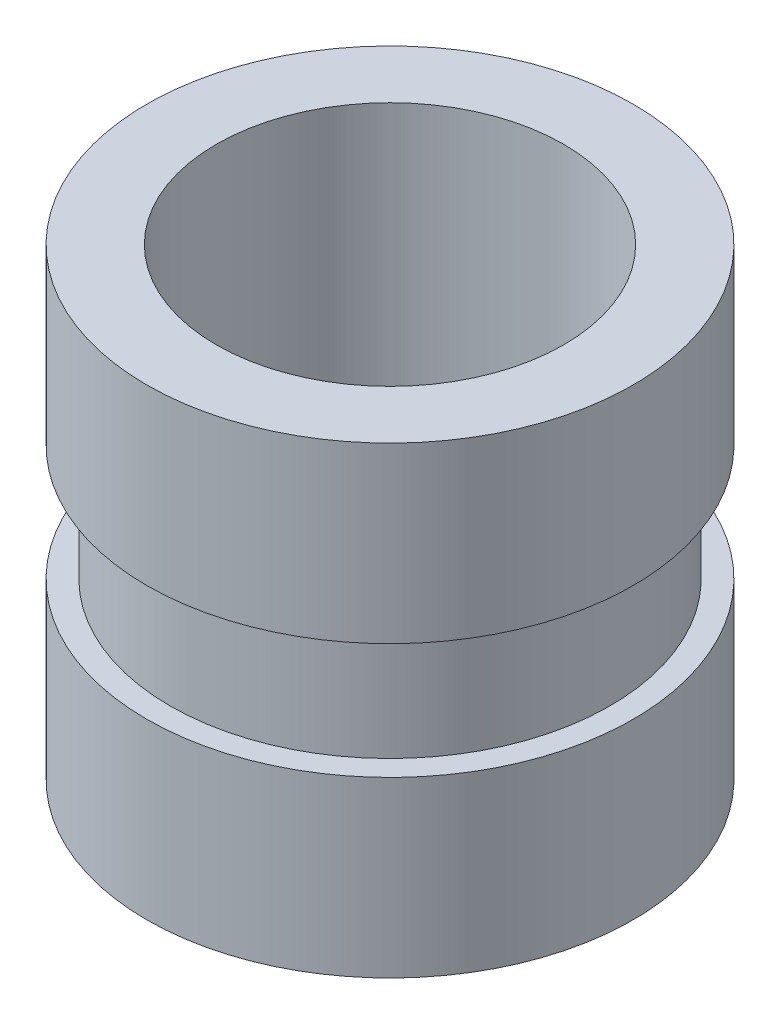
from build123d import *


with BuildPart() as part:
    # Sketch1 → Revolve1 (revolve)
    with BuildSketch(Plane.XY):
        Polygon((1.5, 0), (2.1, 0), (2.1, 1.5), (1.9, 1.5), (1.9, 2.5), (2.1, 2.5), (2.1, 4), (1.5, 4), align=None)
    revolve(axis=Axis((0, 4.902028775, 0), (0, -1, 0)))


solid = part.part
